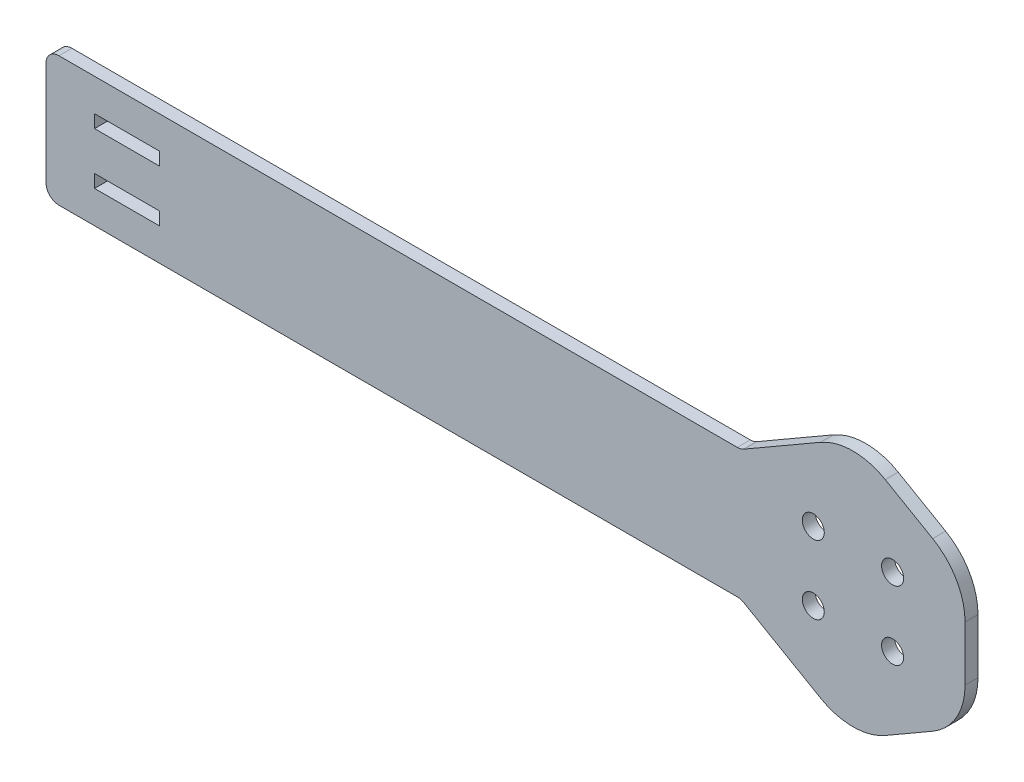
from build123d import *

# Parameters (mm, degrees)
SKETCH1_W           = 10
SKETCH1_H           = 2
SKETCH1_R           = 1.7
BOSS_EXTRUDE3_DEPTH = 2
FILLET5_R           = 10
FILLET6_R           = 10
FILLET7_R           = 10
FILLET8_R           = 10
FILLET14_R          = 2
FILLET15_R          = 2
FILLET16_R          = 2


with BuildPart() as part:
    # Sketch1 → Boss-Extrude3 (new body)
    with BuildSketch(Plane.XY):
        Polygon((124.651481526, 0), (107.330973451, -10), (0, -10), (0, -30), (107.330973451, -30), (124.651481526, -40), (141.971989602, -30), (141.971989602, -10), align=None)
        with Locations((12.5, -16)):
            Rectangle(SKETCH1_W, SKETCH1_H, mode=Mode.SUBTRACT)
        with Locations((12.5, -24)):
            Rectangle(SKETCH1_W, SKETCH1_H, mode=Mode.SUBTRACT)
        with Locations((130.776481526, -14.695594402)):
            Circle(SKETCH1_R, mode=Mode.SUBTRACT)
        with Locations((118.526481526, -25.304405598)):
            Circle(SKETCH1_R, mode=Mode.SUBTRACT)
        with Locations((130.776481526, -25.304405598)):
            Circle(SKETCH1_R, mode=Mode.SUBTRACT)
        with Locations((118.526481526, -14.695594402)):
            Circle(SKETCH1_R, mode=Mode.SUBTRACT)
    extrude(amount=BOSS_EXTRUDE3_DEPTH)

    # Fillet5
    fillet5_edges = [part.edges().sort_by_distance(p)[0] for p in [
        (124.651481526, 0, 1),
    ]]
    fillet(fillet5_edges, radius=FILLET5_R)

    # Fillet6
    fillet6_edges = [part.edges().sort_by_distance(p)[0] for p in [
        (141.971989602, -10, 1),
    ]]
    fillet(fillet6_edges, radius=FILLET6_R)

    # Fillet7
    fillet7_edges = [part.edges().sort_by_distance(p)[0] for p in [
        (141.971989602, -30, 1),
    ]]
    fillet(fillet7_edges, radius=FILLET7_R)

    # Fillet8
    fillet8_edges = [part.edges().sort_by_distance(p)[0] for p in [
        (124.651481526, -40, 1),
    ]]
    fillet(fillet8_edges, radius=FILLET8_R)

    # Fillet14
    fillet14_edges = [part.edges().sort_by_distance(p)[0] for p in [
        (0, -30, 1),
        (0, -10, 1),
    ]]
    fillet(fillet14_edges, radius=FILLET14_R)

    # Fillet15
    fillet15_edges = [part.edges().sort_by_distance(p)[0] for p in [
        (107.330973451, -10, 1),
    ]]
    fillet(fillet15_edges, radius=FILLET15_R)

    # Fillet16
    fillet16_edges = [part.edges().sort_by_distance(p)[0] for p in [
        (107.330973451, -30, 1),
    ]]
    fillet(fillet16_edges, radius=FILLET16_R)


solid = part.part
